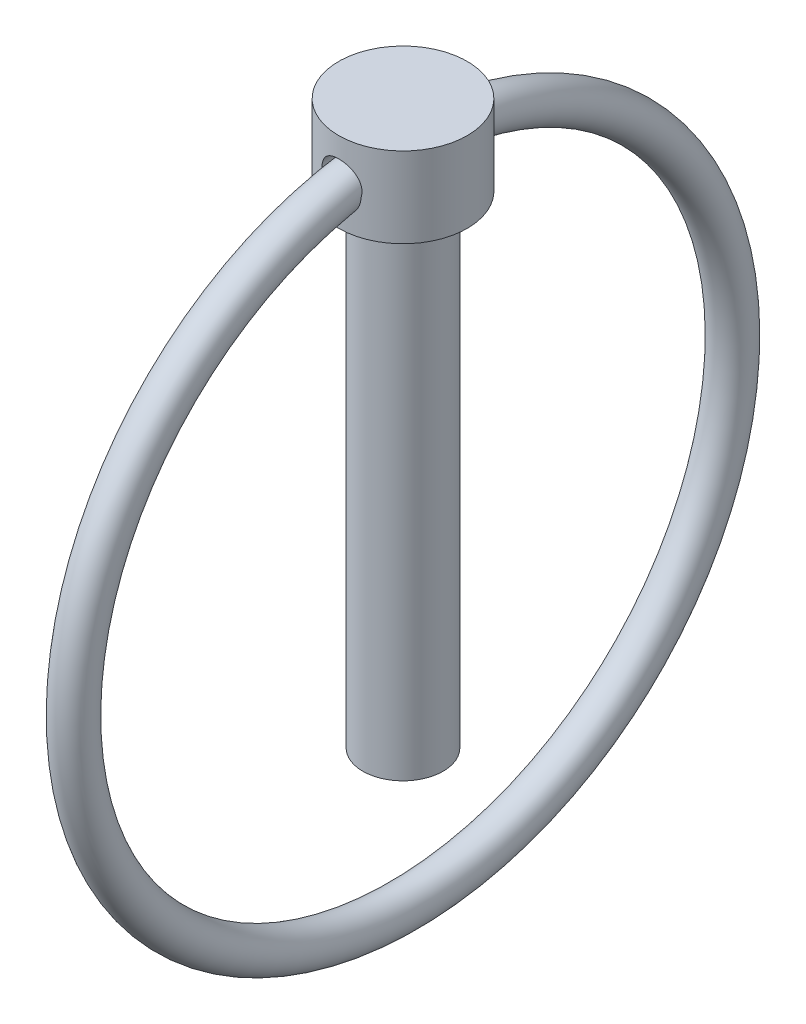
from build123d import *

# Parameters (mm, degrees)
SKETCH1_R               = 2.5
BOSS_EXTRUDE1_DEPTH     = 30
SKETCH2_R               = 4
BOSS_EXTRUDE2_DEPTH     = 5
CUT_EXTRUDE1_DEPTH      = 5
CUT_EXTRUDE1_DEPTH_BACK = 5
SKETCH3_R               = 1.25
SKETCH4_R               = 1.2


with BuildPart() as part:
    # Sketch1 → Boss-Extrude1 (new body)
    with BuildSketch(Plane(origin=(0, 0, 0), x_dir=(1, 0, 0), z_dir=(0, 1, 0))):
        Circle(SKETCH1_R)
    extrude(amount=BOSS_EXTRUDE1_DEPTH)

    # Sketch2 → Boss-Extrude2 (add)
    with BuildSketch(Plane(origin=(0, 30, 0), x_dir=(1, 0, 0), z_dir=(0, 1, 0))):
        Circle(SKETCH2_R)
    extrude(amount=BOSS_EXTRUDE2_DEPTH)

    # Sketch3 → Cut-Extrude1 (cut, two sides: drawn at the far end of the back side and taken through both)
    with BuildSketch(Plane.XY.offset(-CUT_EXTRUDE1_DEPTH_BACK)):
        with Locations((0, 32.5)):
            Circle(SKETCH3_R)
    extrude(amount=CUT_EXTRUDE1_DEPTH + CUT_EXTRUDE1_DEPTH_BACK, mode=Mode.SUBTRACT)

    # Sketch4 → Revolve2 (revolve)
    with BuildSketch(Plane.XY):
        with Locations((0, 32.5)):
            Circle(SKETCH4_R)
    revolve(axis=Axis((-16.496589734, 12, 0), (1, 0, 0)))


solid = part.part
